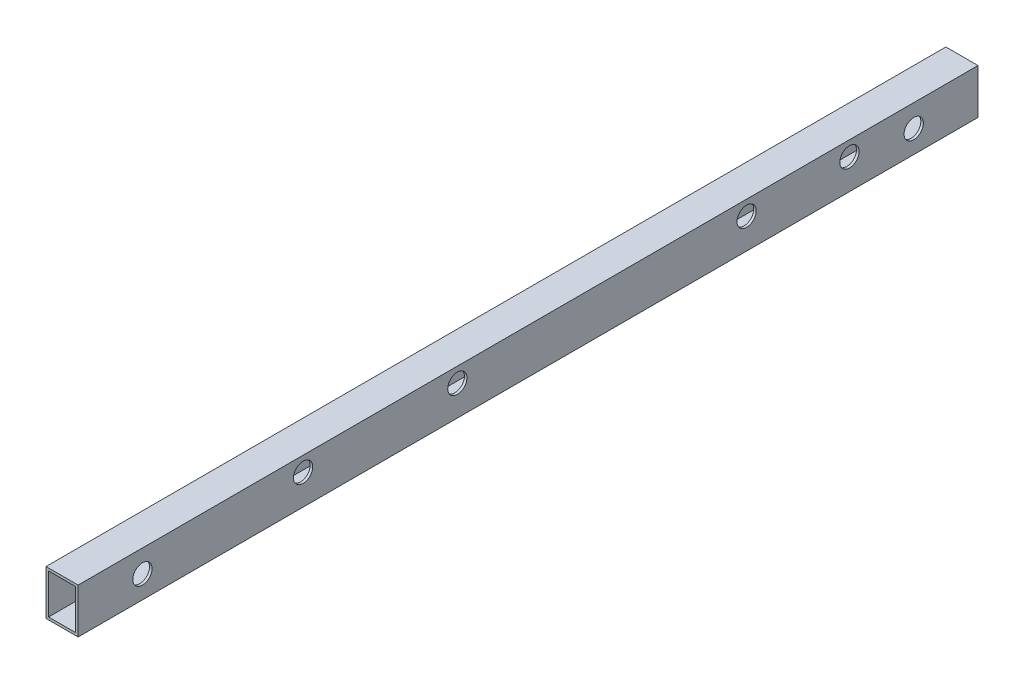
from build123d import *

# Parameters (mm, degrees)
SKETCH1_W           = 50
SKETCH1_H           = 70
SKETCH1_W_2         = 42
SKETCH1_H_2         = 62
BOSS_EXTRUDE2_DEPTH = 1400
SKETCH2_R           = 15
CUT_EXTRUDE1_DEPTH  = 1403.640367307
SKETCH3_R           = 15
CUT_EXTRUDE2_DEPTH  = 1403.640367307


with BuildPart() as part:
    # Sketch1 → Boss-Extrude2 (new body)
    with BuildSketch(Plane.XY):
        with Locations((25, -35)):
            Rectangle(SKETCH1_W, SKETCH1_H)
        with Locations((25, -35)):
            Rectangle(SKETCH1_W_2, SKETCH1_H_2, mode=Mode.SUBTRACT)
    extrude(amount=BOSS_EXTRUDE2_DEPTH)

    # Sketch2 → Cut-Extrude1 (cut, through all)
    with BuildSketch(Plane(origin=(50, 0, 0), x_dir=(0, 0, -1), z_dir=(1, 0, 0))):
        with Locations((-1050, -23)):
            Circle(SKETCH2_R)
        with Locations((-200, -23)):
            Circle(SKETCH2_R)
        with Locations((-810, -23)):
            Circle(SKETCH2_R)
        with Locations((-360, -23)):
            Circle(SKETCH2_R)
    extrude(amount=-CUT_EXTRUDE1_DEPTH, mode=Mode.SUBTRACT)

    # Sketch3 → Cut-Extrude2 (cut, through all)
    with BuildSketch(Plane(origin=(50, 0, 0), x_dir=(0, 0, -1), z_dir=(1, 0, 0))):
        with Locations((-1300, -35)):
            Circle(SKETCH3_R)
        with Locations((-100, -35)):
            Circle(SKETCH3_R)
    extrude(amount=-CUT_EXTRUDE2_DEPTH, mode=Mode.SUBTRACT)


solid = part.part
